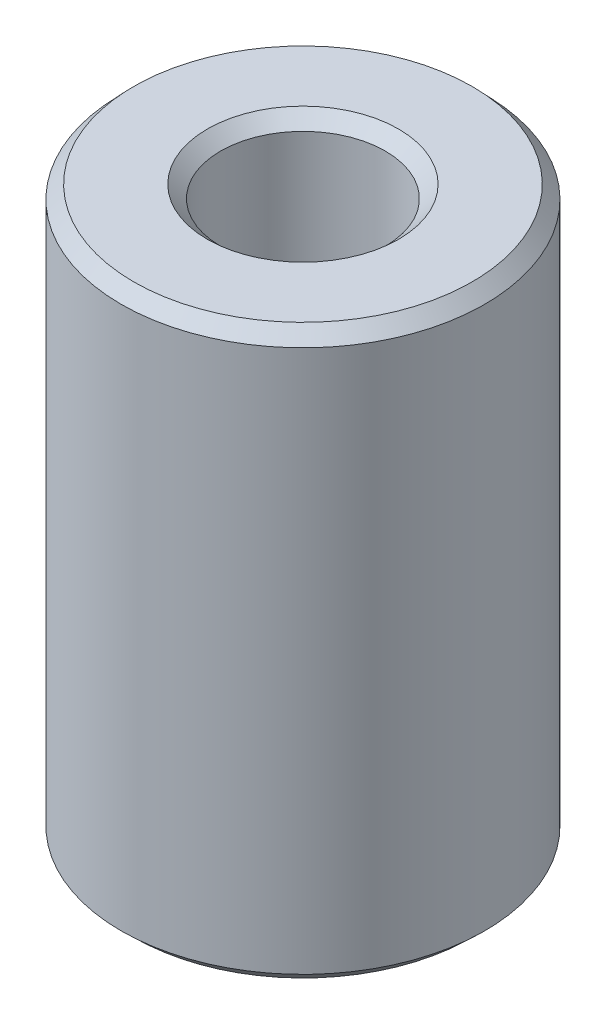
from build123d import *
from OCP.BRepFilletAPI import BRepFilletAPI_MakeChamfer

# Parameters (mm, degrees)
SKETCH1_R           = 42.5
BOSS_EXTRUDE1_DEPTH = 132.901870392
SKETCH2_R           = 19.265080562
CUT_EXTRUDE1_DEPTH  = 146.860917156
CHAMFER1_SIZE       = 3.089720611
CHAMFER1_SIZE2      = 2.921539282


with BuildPart() as part:
    # Sketch1 → Boss-Extrude1 (new body)
    with BuildSketch(Plane(origin=(0, 0, 0), x_dir=(1, 0, 0), z_dir=(0, 1, 0))):
        Circle(SKETCH1_R)
    extrude(amount=BOSS_EXTRUDE1_DEPTH)

    # Sketch2 → Cut-Extrude1 (cut, through all)
    with BuildSketch(Plane(origin=(0, 0, 0), x_dir=(1, 0, 0), z_dir=(0, 1, 0))):
        Circle(SKETCH2_R)
    extrude(amount=CUT_EXTRUDE1_DEPTH, mode=Mode.SUBTRACT)

    # Chamfer1: one chamfer whose edges measure the first distance from different faces: ONE call of the kernel's chamfer builder (chamfer() names one face for all edges)
    chamfer1_edges_1 = [part.edges().sort_by_distance(p)[0] for p in [
        (-19.265080562, 132.901870392, 0),
    ]]
    chamfer1_side_1 = [part.faces().sort_by_distance(p)[0] for p in [
        (-41.297918472, 132.901870392, 0),
    ]]
    chamfer1_edges_2 = [part.edges().sort_by_distance(p)[0] for p in [
        (-19.265080562, 0, 0),
    ]]
    chamfer1_side_2 = [part.faces().sort_by_distance(p)[0] for p in [
        (-19.265080562, 66.450935196, 0),
    ]]
    chamfer1_edges_3 = [part.edges().sort_by_distance(p)[0] for p in [
        (-42.5, 0, 0),
    ]]
    chamfer1_side_3 = [part.faces().sort_by_distance(p)[0] for p in [
        (-41.297918472, 0, 0),
    ]]
    chamfer1_edges_4 = [part.edges().sort_by_distance(p)[0] for p in [
        (-42.5, 132.901870392, 0),
    ]]
    chamfer1_side_4 = [part.faces().sort_by_distance(p)[0] for p in [
        (-42.5, 66.450935196, 0),
    ]]
    chamfer1 = BRepFilletAPI_MakeChamfer(part.part.solid().wrapped)
    for e in chamfer1_edges_1:
        chamfer1.Add(CHAMFER1_SIZE, CHAMFER1_SIZE2, e.wrapped, chamfer1_side_1[0].wrapped)  # the first distance lies on this face
    for e in chamfer1_edges_2:
        chamfer1.Add(CHAMFER1_SIZE, CHAMFER1_SIZE2, e.wrapped, chamfer1_side_2[0].wrapped)  # the first distance lies on this face
    for e in chamfer1_edges_3:
        chamfer1.Add(CHAMFER1_SIZE, CHAMFER1_SIZE2, e.wrapped, chamfer1_side_3[0].wrapped)  # the first distance lies on this face
    for e in chamfer1_edges_4:
        chamfer1.Add(CHAMFER1_SIZE, CHAMFER1_SIZE2, e.wrapped, chamfer1_side_4[0].wrapped)  # the first distance lies on this face
    add(Compound.cast(chamfer1.Shape()), mode=Mode.REPLACE)


solid = part.part
